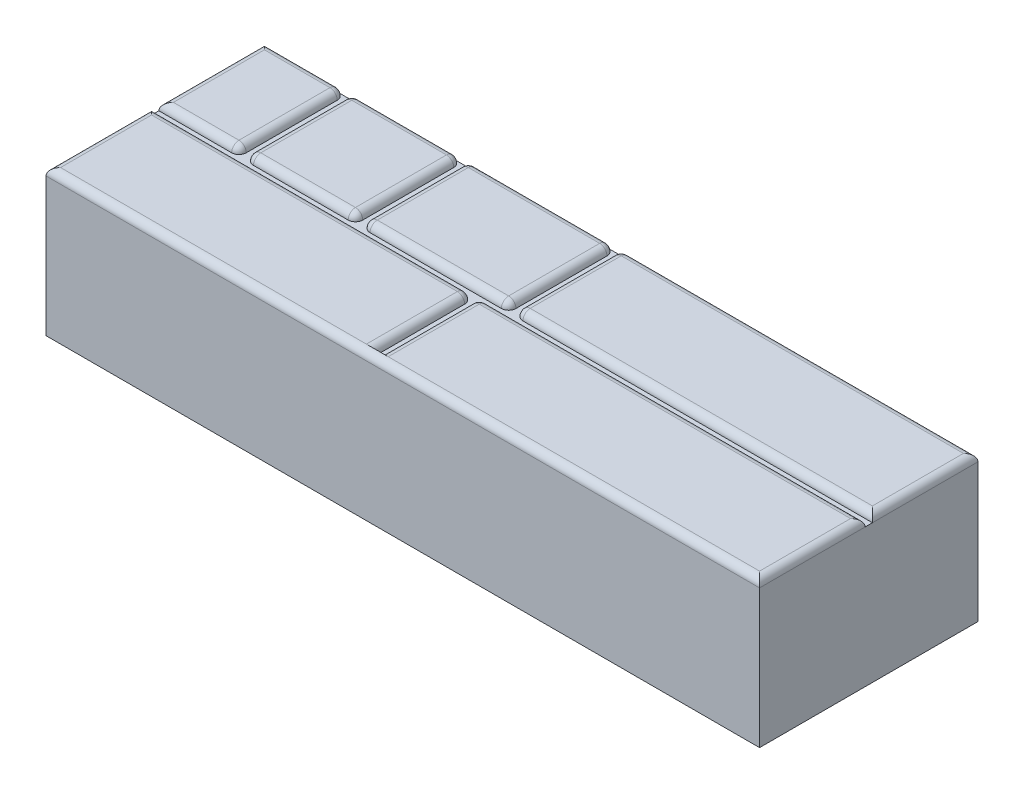
from build123d import *

# Parameters (mm, degrees)
SKETCH1_W           = 980
SKETCH1_H           = 300
BOSS_EXTRUDE1_DEPTH = 200
CUT_EXTRUDE1_DEPTH  = 10
FILLET1_R           = 10
SKETCH3_W           = 10
SKETCH3_H           = 145
SKETCH3_W_2         = 9.596436682
SKETCH3_H_2         = 135
CUT_EXTRUDE2_DEPTH  = 10
FILLET2_R           = 10


with BuildPart() as part:
    # Sketch1 → Boss-Extrude1 (new body)
    with BuildSketch(Plane(origin=(0, 0, 0), x_dir=(1, 0, 0), z_dir=(0, 1, 0))):
        Rectangle(SKETCH1_W, SKETCH1_H)
    extrude(amount=BOSS_EXTRUDE1_DEPTH)

    # Sketch2 → Cut-Extrude1 (cut)
    with BuildSketch(Plane(origin=(0, 200, 0), x_dir=(1, 0, 0), z_dir=(0, 1, 0))):
        Polygon((0, -5), (490, -5), (490, 5), (-490, 5), (-490, -5), align=None)
    extrude(amount=-CUT_EXTRUDE1_DEPTH, mode=Mode.SUBTRACT)

    # Fillet1
    fillet1_edges = [part.edges().sort_by_distance(p)[0] for p in [
        (490, 200, 77.5),
        (490, 200, -77.5),
        (0, 200, -150),
        (0, 200, 150),
        (0, 200, -5),
        (0, 200, 5),
        (-490, 200, -77.5),
        (-490, 200, 77.5),
    ]]
    fillet(fillet1_edges, radius=FILLET1_R - 0.0001)  # a hair under: the kernel refuses the full size

    # Sketch3 → Cut-Extrude2 (cut)
    with BuildSketch(Plane(origin=(0, 200, 0), x_dir=(1, 0, 0), z_dir=(0, 1, 0))):
        with Locations((-375, 77.5)):
            Rectangle(SKETCH3_W, SKETCH3_H)
        with Locations((-215, 77.5)):
            Rectangle(SKETCH3_W, SKETCH3_H)
        with Locations((-4.798218341, 77.5)):
            Rectangle(SKETCH3_W_2, SKETCH3_H)
        with Locations((-45, -72.5)):
            Rectangle(SKETCH3_W, SKETCH3_H_2)
    extrude(amount=-CUT_EXTRUDE2_DEPTH, mode=Mode.SUBTRACT)

    # Fillet2
    fillet2_edges = [part.edges().sort_by_distance(p)[0] for p in [
        (-50, 200, 77.49995),
        (-40, 200, 77.49995),
        (0, 200, -77.5),
        (-9.596436682, 200, -77.5),
        (-210, 200, -77.5),
        (-380, 200, -77.5),
        (-220, 200, -77.5),
        (-370, 200, -77.5),
        (-50, 197.071097101, 7.928902899),
        (-40, 197.071097101, 7.928902899),
        (0, 197.071097101, -7.928902899),
        (0, 197.071097101, -147.071097101),
        (-9.596436682, 197.071097101, -147.071097101),
        (-9.596436682, 197.071097101, -7.928902899),
        (-210, 197.071097101, -7.928902899),
        (-210, 197.071097101, -147.071097101),
        (-380, 197.071097101, -147.071097101),
        (-380, 197.071097101, -7.928902899),
        (-220, 197.071097101, -147.071097101),
        (-220, 197.071097101, -7.928902899),
        (-370, 197.071097101, -7.928902899),
        (-370, 197.071097101, -147.071097101),
    ]]
    fillet(fillet2_edges, radius=FILLET2_R - 0.0001)  # a hair under: the kernel refuses the full size


solid = part.part
